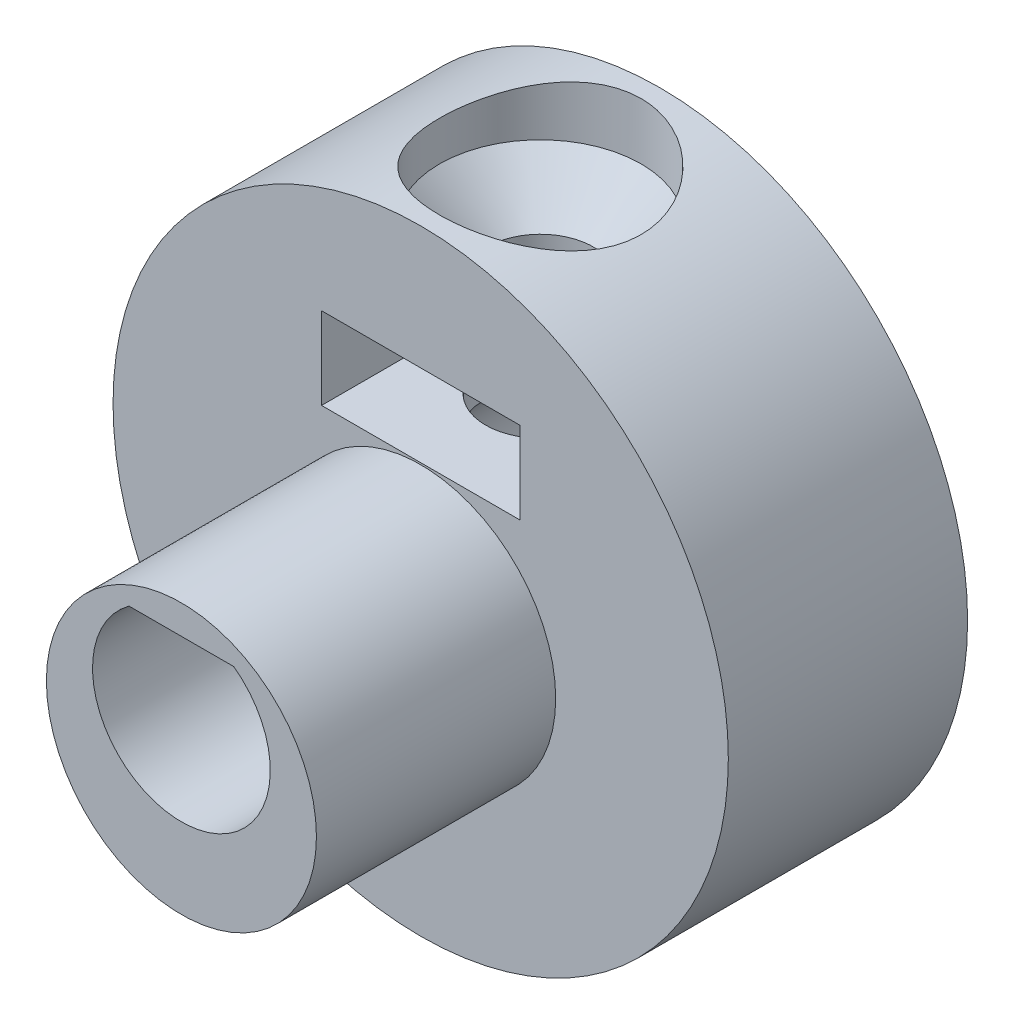
from build123d import *

# Parameters (mm, degrees)
ESQUISSE1_R             = 9
BOSS_EXTRU_1_DEPTH      = 7
ESQUISSE2_W             = 5.8
ESQUISSE2_H             = 2.4
ENL_V_MAT_EXTRU_1_DEPTH = 15.525839046
ESQUISSE7_R             = 2.95
ENL_V_MAT_EXTRU_8_DEPTH = 21.802884576
CHANFREIN1_SIZE         = 2.5
CHANFREIN1_SIZE_2       = 2.457485256
ESQUISSE9_R             = 3.95
BOSS_EXTRU_2_DEPTH      = 7
ENL_V_MAT_EXTRU_9_DEPTH = 19.92088803


# Read off the part's stored shape, not the designer's step: Enlèv. mat.-Extru.2
with BuildPart() as part:
    # Esquisse1 → Boss.-Extru.1 (new body)
    with BuildSketch(Plane.XY):
        Circle(ESQUISSE1_R)
    extrude(amount=BOSS_EXTRU_1_DEPTH)

    # Esquisse2 → Enlèv. mat.-Extru.1 (cut, through all)
    with BuildSketch(Plane(origin=(0, 0, 0), x_dir=(-1, 0, 0), z_dir=(0, 0, -1))):
        with Locations((0, 4.2)):
            Rectangle(ESQUISSE2_W, ESQUISSE2_H)
    extrude(amount=-ENL_V_MAT_EXTRU_1_DEPTH, mode=Mode.SUBTRACT)

    # Enlèv. mat.-Extru.2 outline → Enlèv. mat.-Extru.2 (revolve, cut)
    with BuildSketch(Plane.XY.offset(3.5)):
        Polygon((0, 5.4), (1.558107844, 5.4), (1.49526864, 9.000055608), (0, 9.000055608), align=None)
        Polygon((1.6, 3), (0, 3), (0, 1), (1.56508987, 1), align=None)
    revolve(axis=Axis((0, 0, 3.5), (0, 1, 0)), mode=Mode.SUBTRACT)

    # Esquisse7 → Enlèv. mat.-Extru.8 (cut, through all)
    with BuildSketch(Plane(origin=(0, 8.4, 0), x_dir=(1, 0, 0), z_dir=(0, 1, 0))):
        with Locations(Location((0, -3.5, 0), (0, 0, 90))):
            Circle(ESQUISSE7_R)
    extrude(amount=ENL_V_MAT_EXTRU_8_DEPTH, mode=Mode.SUBTRACT)

    # Chanfrein1
    # the kernel refuses this chamfer: 2.5, 2.457485256 mm, written as the material it takes off along each edge
    with BuildSketch(Plane(origin=(0, 8.4, 3.5), x_dir=(1, 0, 0), z_dir=(0, 0, 1))) as chanfrein1_piece_1_section:
        Polygon((1.50574265 + CHANFREIN1_SIZE, 0), (1.50574265 + CHANFREIN1_SIZE_2 * 0.0174524063286, -CHANFREIN1_SIZE_2 * 0.999847695023), (1.50574265, 0), align=None)
    chanfrein1_piece_1 = revolve(axis=Axis((0, 8.4, 3.5), (0, 1, 0)), mode=Mode.PRIVATE)
    chanfrein1_piece_1 = chanfrein1_piece_1 & Plane(origin=(0, 6.666447792, 3.5), x_dir=(0, 0, -1), z_dir=(0, -1, 0)) * Cylinder(2.95, 17, mode=Mode.PRIVATE)
    add(chanfrein1_piece_1, mode=Mode.SUBTRACT)

    # Esquisse9 → Boss.-Extru.2 (add)
    with BuildSketch(Plane.XY.offset(7)):
        with Locations((0, -1)):
            Circle(ESQUISSE9_R)
    extrude(amount=BOSS_EXTRU_2_DEPTH)

    # Esquisse10 → Enlèv. mat.-Extru.9 (cut, through all)
    with BuildSketch(Plane(origin=(0, 0, 0), x_dir=(-1, 0, 0), z_dir=(0, 0, -1))):
        with BuildLine():
            Line((-1.532970972, 2.1), (1.532970972, 2.1))
            ThreePointArc((1.532970972, 2.1), (0, -2.6), (-1.532970972, 2.1))
        make_face()
    extrude(amount=-ENL_V_MAT_EXTRU_9_DEPTH, mode=Mode.SUBTRACT)


solid = part.part
